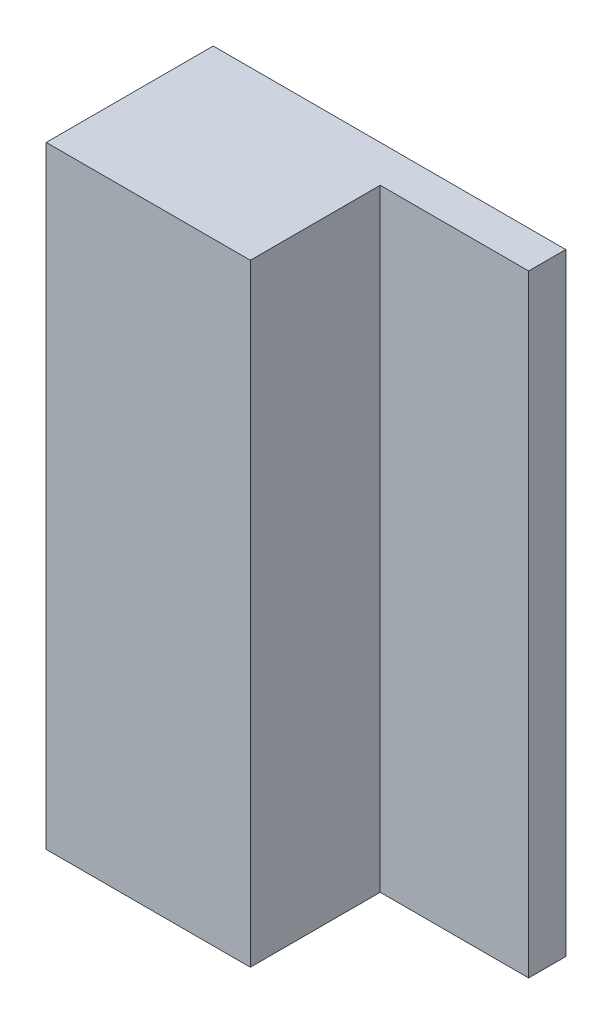
from build123d import *

# Parameters (mm, degrees)
SKETCH1_W           = 19
SKETCH1_H           = 33
BOSS_EXTRUDE1_DEPTH = 9
SKETCH3_W           = 8
SKETCH3_H           = 33
CUT_EXTRUDE1_DEPTH  = 7


with BuildPart() as part:
    # Sketch1 → Boss-Extrude1 (new body)
    with BuildSketch(Plane.XY):
        with Locations((9.5, 16.5)):
            Rectangle(SKETCH1_W, SKETCH1_H)
    extrude(amount=BOSS_EXTRUDE1_DEPTH)

    # Sketch3 → Cut-Extrude1 (cut)
    with BuildSketch(Plane.XY.offset(9)):
        with Locations((15, 16.5)):
            Rectangle(SKETCH3_W, SKETCH3_H)
    extrude(amount=-CUT_EXTRUDE1_DEPTH, mode=Mode.SUBTRACT)


solid = part.part
